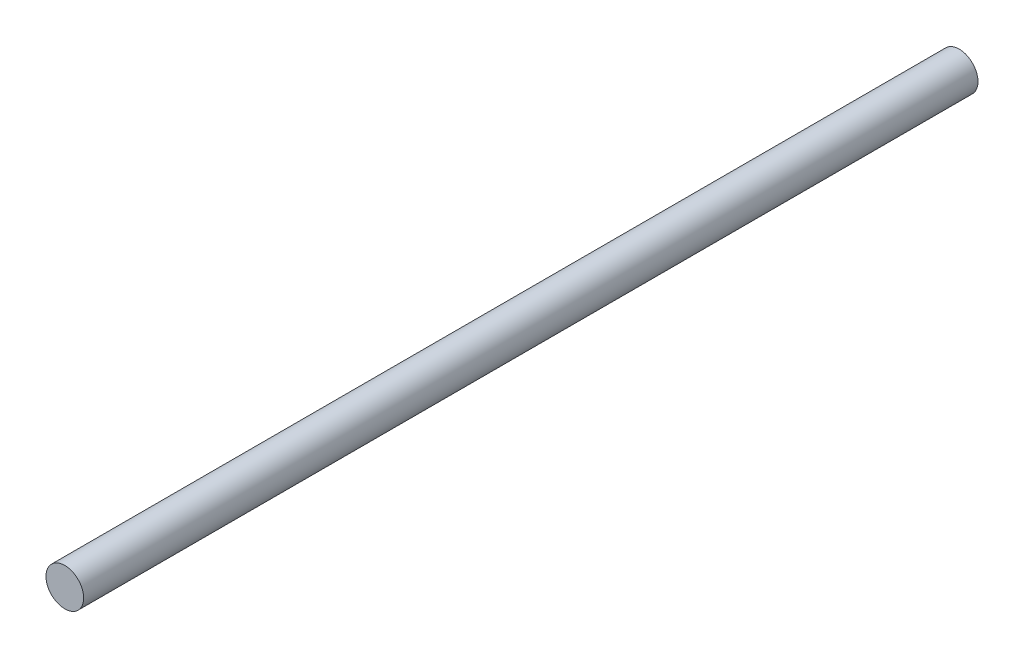
from build123d import *

# Parameters (mm, degrees)
SKETCH1_R           = 4
BOSS_EXTRUDE1_DEPTH = 190


with BuildPart() as part:
    # Sketch1 → Boss-Extrude1 (new body)
    with BuildSketch(Plane.XY):
        Circle(SKETCH1_R)
    extrude(amount=BOSS_EXTRUDE1_DEPTH)


solid = part.part
